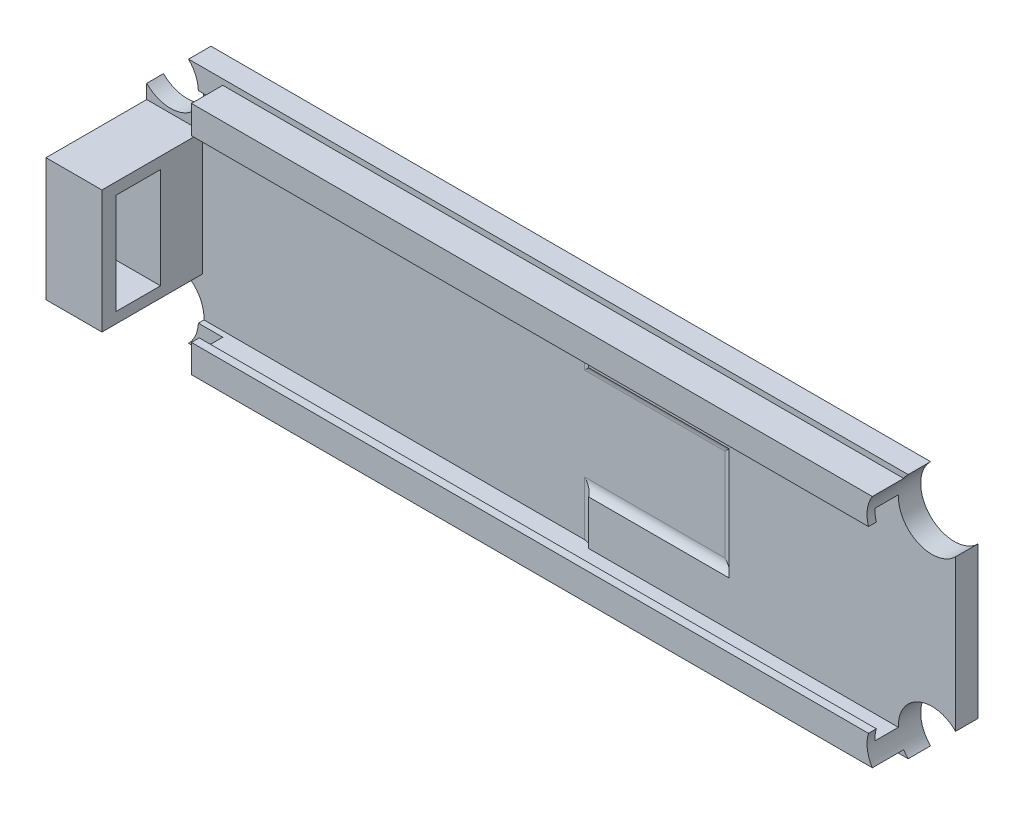
from build123d import *

# Parameters (mm, degrees)
SKIZZE1_W                       = 22
SKIZZE1_H                       = 72.8
AUFSATZ_LINEAR_AUSTRAGEN1_DEPTH = 2
SKIZZE2_R                       = 3
SCHNITT_LINEAR_AUSTRAGEN1_DEPTH = 2
SKIZZE3_W                       = 65.5
SKIZZE3_H                       = 21
AUFSATZ_LINEAR_AUSTRAGEN2_DEPTH = 2.8
SCHNITT_LINEAR_AUSTRAGEN2_DEPTH = 67.590464783
SKIZZE5_R                       = 3
SCHNITT_LINEAR_AUSTRAGEN4_DEPTH = 39.128729326
SKIZZE6_W                       = 18
SKIZZE6_H                       = 1
SCHNITT_LINEAR_AUSTRAGEN5_DEPTH = 40
SKIZZE8_W                       = 15
SKIZZE8_H                       = 10
SCHNITT_LINEAR_AUSTRAGEN6_DEPTH = 0.5
VERRUNDUNG3_R                   = 1
SKIZZE9_W                       = 5
SKIZZE9_H                       = 11
AUFSATZ_LINEAR_AUSTRAGEN3_DEPTH = 9
SKIZZE10_W                      = 9
SKIZZE10_H                      = 4
SCHNITT_LINEAR_AUSTRAGEN7_DEPTH = 75.371298227


with BuildPart() as part:
    # Skizze1 → Aufsatz-Linear austragen1 (new body)
    with BuildSketch(Plane(origin=(0, 0, 0), x_dir=(0, 1, 0), z_dir=(0, 0, 1))):
        Rectangle(SKIZZE1_W, SKIZZE1_H)
    extrude(amount=AUFSATZ_LINEAR_AUSTRAGEN1_DEPTH)

    # Skizze2 → Schnitt-Linear austragen1 (cut)
    with BuildSketch(Plane.XY.offset(2)):
        with Locations((-34.28, 8.88)):
            Circle(SKIZZE2_R)
        with Locations((-34.28, -8.88)):
            Circle(SKIZZE2_R)
        with Locations((34.28, -8.88)):
            Circle(SKIZZE2_R)
        with Locations((34.28, 8.88)):
            Circle(SKIZZE2_R)
    extrude(amount=-SCHNITT_LINEAR_AUSTRAGEN1_DEPTH, mode=Mode.SUBTRACT)

    # Skizze3 → Aufsatz-Linear austragen2 (add)
    with BuildSketch(Plane.XY.offset(2)):
        with Locations((3.65, 0)):
            Rectangle(SKIZZE3_W, SKIZZE3_H)
    extrude(amount=AUFSATZ_LINEAR_AUSTRAGEN2_DEPTH)

    # Skizze4 → Schnitt-Linear austragen2 (cut, through all)
    with BuildSketch(Plane(origin=(-29.1, 0, 0), x_dir=(0, -1, 0), z_dir=(-1, 0, 0))):
        Polygon((-8, 4.8), (8, 4.8), (8, 4.1), (9, 4.1), (9, 2), (-9, 2), (-9, 4.1), (-8, 4.1), align=None)
    extrude(amount=-SCHNITT_LINEAR_AUSTRAGEN2_DEPTH, mode=Mode.SUBTRACT)

    # Skizze5 → Schnitt-Linear austragen4 (cut, through all)
    with BuildSketch(Plane(origin=(0, 0, 2), x_dir=(1, 0, 0), z_dir=(0, 0, -1))):
        with Locations((34.28, -8.88)):
            Circle(SKIZZE5_R)
        with Locations((34.28, 8.88)):
            Circle(SKIZZE5_R)
    extrude(amount=-SCHNITT_LINEAR_AUSTRAGEN4_DEPTH, mode=Mode.SUBTRACT)

    # Skizze6 → Schnitt-Linear austragen5 (cut)
    with BuildSketch(Plane(origin=(-36.4, 0, 0), x_dir=(0, -1, 0), z_dir=(-1, 0, 0))):
        with Locations((0, 2)):
            Rectangle(SKIZZE6_W, SKIZZE6_H)
    extrude(amount=-SCHNITT_LINEAR_AUSTRAGEN5_DEPTH, mode=Mode.SUBTRACT)

    # Skizze8 → Schnitt-Linear austragen6 (cut)
    with BuildSketch(Plane.XY.offset(2)):
        with Locations((8.655984658, -0.007335612)):
            Rectangle(SKIZZE8_W, SKIZZE8_H)
    extrude(amount=-SCHNITT_LINEAR_AUSTRAGEN6_DEPTH, mode=Mode.SUBTRACT)

    # Verrundung3
    # the kernel refuses this fillet: 1 mm, written as the material it adds along each edge
    with BuildSketch(Plane(origin=(3.6, -9, 1.5), x_dir=(0, 0, 1), z_dir=(0, 1, 0))) as verrundung3_piece_1:
        with BuildLine():
            CenterArc((1, -0.866025404), VERRUNDUNG3_R, 120, 60)
            Line((0, -0.866025404), (-0.02, -0.866025404))
            Line((-0.02, -0.866025404), (-0.02, 0))
            Line((-0.02, 0), (0, 0.02))
            ThreePointArc((0, 0.02), (0.25, 0.02), (0.49, 0.017320508))
            Line((0.49, 0.017320508), (0.5, 0))
        make_face()
    extrude(amount=3.992664388)
    with BuildSketch(Plane(origin=(3.6, -5.007335612, 1.5), x_dir=(0, 0, 1), z_dir=(1, 0, 0)), Plane(origin=(16.155984658, 4.992664388, 1.5), x_dir=(0, 0, 1), z_dir=(-1, 0, 0))) as verrundung3_piece_2:
        with BuildLine():
            CenterArc((1, -0.866025404), VERRUNDUNG3_R, 120, 60)
            Line((0, -0.866025404), (-0.02, -0.866025404))
            Line((-0.02, -0.866025404), (-0.02, 0))
            Line((-0.02, 0), (0, 0.02))
            ThreePointArc((0, 0.02), (0.25, 0.02), (0.49, 0.017320508))
            Line((0.49, 0.017320508), (0.5, 0))
        make_face()
    extrude(amount=12.555984658)
    with BuildSketch(Plane(origin=(3.6, 4.992664388, 1.5), x_dir=(0, 0, 1), z_dir=(0, 1, 0))) as verrundung3_piece_3:
        with BuildLine():
            CenterArc((1, -0.866025404), VERRUNDUNG3_R, 120, 60)
            Line((0, -0.866025404), (-0.02, -0.866025404))
            Line((-0.02, -0.866025404), (-0.02, 0))
            Line((-0.02, 0), (0, 0.02))
            ThreePointArc((0, 0.02), (0.25, 0.02), (0.49, 0.017320508))
            Line((0.49, 0.017320508), (0.5, 0))
        make_face()
    extrude(amount=4.007335612)
    with BuildSketch(Plane(origin=(16.155984658, -5.007335612, 1.5), x_dir=(0, 0, 1), z_dir=(0, 1, 0))) as verrundung3_piece_4:
        with BuildLine():
            CenterArc((1, -0.866025404), VERRUNDUNG3_R, 120, 60)
            Line((0, -0.866025404), (-0.02, -0.866025404))
            Line((-0.02, -0.866025404), (-0.02, 0))
            Line((-0.02, 0), (0, 0.02))
            ThreePointArc((0, 0.02), (0.25, 0.02), (0.49, 0.017320508))
            Line((0.49, 0.017320508), (0.5, 0))
        make_face()
    extrude(amount=10)
    with BuildSketch(Plane(origin=(3.6, -9, 1.5), x_dir=(0, 0, 1), z_dir=(0, 1, 0))) as verrundung3_piece_5a_section:
        with BuildLine():
            CenterArc((1, -0.866025404), VERRUNDUNG3_R, 120, 60)
            Line((0, -0.866025404), (-0.02, -0.866025404))
            Line((-0.02, -0.866025404), (-0.02, 0))
            Line((-0.02, 0), (0, 0.02))
            ThreePointArc((0, 0.02), (0.25, 0.02), (0.49, 0.017320508))
            Line((0.49, 0.017320508), (0.5, 0))
        make_face()
    verrundung3_piece_5a = extrude(amount=6.157727897, mode=Mode.PRIVATE)
    verrundung3_piece_5a = split(verrundung3_piece_5a, bisect_by=Plane(origin=(3.383689554, -5.007335612, 1.629516711), z_dir=(0, 1, 0)), keep=Keep.TOP, mode=Mode.PRIVATE)
    with BuildSketch(Plane(origin=(1.434936491, -5.007335612, 1.5), x_dir=(0, 0, 1), z_dir=(1, 0, 0))) as verrundung3_piece_5b_section:
        with BuildLine():
            CenterArc((1, -0.866025404), VERRUNDUNG3_R, 120, 60)
            Line((0, -0.866025404), (-0.02, -0.866025404))
            Line((-0.02, -0.866025404), (-0.02, 0))
            Line((-0.02, 0), (0, 0.02))
            ThreePointArc((0, 0.02), (0.25, 0.02), (0.49, 0.017320508))
            Line((0.49, 0.017320508), (0.5, 0))
        make_face()
    verrundung3_piece_5b = extrude(amount=14.721048168, mode=Mode.PRIVATE)
    verrundung3_piece_5b = split(verrundung3_piece_5b, bisect_by=Plane(origin=(3.6, -4.791025166, 1.629516711), z_dir=(-1, 0, 0)), keep=Keep.TOP, mode=Mode.PRIVATE)
    verrundung3_piece_5 = verrundung3_piece_5a & verrundung3_piece_5b
    add(verrundung3_piece_5)
    with BuildSketch(Plane(origin=(3.6, -5.007335612, 1.5), x_dir=(0, 0, 1), z_dir=(1, 0, 0))) as verrundung3_piece_6a_section:
        with BuildLine():
            CenterArc((1, -0.866025404), VERRUNDUNG3_R, 120, 60)
            Line((0, -0.866025404), (-0.02, -0.866025404))
            Line((-0.02, -0.866025404), (-0.02, 0))
            Line((-0.02, 0), (0, 0.02))
            ThreePointArc((0, 0.02), (0.25, 0.02), (0.49, 0.017320508))
            Line((0.49, 0.017320508), (0.5, 0))
        make_face()
    verrundung3_piece_6a = extrude(amount=14.721048168, mode=Mode.PRIVATE)
    verrundung3_piece_6a = split(verrundung3_piece_6a, bisect_by=Plane(origin=(16.155984658, -4.791025166, 1.629516711), z_dir=(1, 0, 0)), keep=Keep.TOP, mode=Mode.PRIVATE)
    with BuildSketch(Plane(origin=(16.155984658, -7.172399122, 1.5), x_dir=(0, 0, 1), z_dir=(0, 1, 0))) as verrundung3_piece_6b_section:
        with BuildLine():
            CenterArc((1, -0.866025404), VERRUNDUNG3_R, 120, 60)
            Line((0, -0.866025404), (-0.02, -0.866025404))
            Line((-0.02, -0.866025404), (-0.02, 0))
            Line((-0.02, 0), (0, 0.02))
            ThreePointArc((0, 0.02), (0.25, 0.02), (0.49, 0.017320508))
            Line((0.49, 0.017320508), (0.5, 0))
        make_face()
    verrundung3_piece_6b = extrude(amount=12.165063509, mode=Mode.PRIVATE)
    verrundung3_piece_6b = split(verrundung3_piece_6b, bisect_by=Plane(origin=(15.939674213, -5.007335612, 1.629516711), z_dir=(0, -1, 0)), keep=Keep.TOP, mode=Mode.PRIVATE)
    verrundung3_piece_6 = verrundung3_piece_6a & verrundung3_piece_6b
    add(verrundung3_piece_6)
    with BuildSketch(Plane(origin=(16.155984658, 4.992664388, 1.5), x_dir=(0, 0, 1), z_dir=(-1, 0, 0))) as verrundung3_piece_7a_section:
        with BuildLine():
            CenterArc((1, -0.866025404), VERRUNDUNG3_R, 120, 60)
            Line((0, -0.866025404), (-0.02, -0.866025404))
            Line((-0.02, -0.866025404), (-0.02, 0))
            Line((-0.02, 0), (0, 0.02))
            ThreePointArc((0, 0.02), (0.25, 0.02), (0.49, 0.017320508))
            Line((0.49, 0.017320508), (0.5, 0))
        make_face()
    verrundung3_piece_7a = extrude(amount=14.721048168, mode=Mode.PRIVATE)
    verrundung3_piece_7a = split(verrundung3_piece_7a, bisect_by=Plane(origin=(3.6, 4.776353942, 1.629516711), z_dir=(-1, 0, 0)), keep=Keep.TOP, mode=Mode.PRIVATE)
    with BuildSketch(Plane(origin=(3.6, 2.827600878, 1.5), x_dir=(0, 0, 1), z_dir=(0, 1, 0))) as verrundung3_piece_7b_section:
        with BuildLine():
            CenterArc((1, -0.866025404), VERRUNDUNG3_R, 120, 60)
            Line((0, -0.866025404), (-0.02, -0.866025404))
            Line((-0.02, -0.866025404), (-0.02, 0))
            Line((-0.02, 0), (0, 0.02))
            ThreePointArc((0, 0.02), (0.25, 0.02), (0.49, 0.017320508))
            Line((0.49, 0.017320508), (0.5, 0))
        make_face()
    verrundung3_piece_7b = extrude(amount=6.172399122, mode=Mode.PRIVATE)
    verrundung3_piece_7b = split(verrundung3_piece_7b, bisect_by=Plane(origin=(3.383689554, 4.992664388, 1.629516711), z_dir=(0, -1, 0)), keep=Keep.TOP, mode=Mode.PRIVATE)
    verrundung3_piece_7 = verrundung3_piece_7a & verrundung3_piece_7b
    add(verrundung3_piece_7)
    with BuildSketch(Plane(origin=(16.155984658, -5.007335612, 1.5), x_dir=(0, 0, 1), z_dir=(0, 1, 0))) as verrundung3_piece_8a_section:
        with BuildLine():
            CenterArc((1, -0.866025404), VERRUNDUNG3_R, 120, 60)
            Line((0, -0.866025404), (-0.02, -0.866025404))
            Line((-0.02, -0.866025404), (-0.02, 0))
            Line((-0.02, 0), (0, 0.02))
            ThreePointArc((0, 0.02), (0.25, 0.02), (0.49, 0.017320508))
            Line((0.49, 0.017320508), (0.5, 0))
        make_face()
    verrundung3_piece_8a = extrude(amount=12.165063509, mode=Mode.PRIVATE)
    verrundung3_piece_8a = split(verrundung3_piece_8a, bisect_by=Plane(origin=(15.939674213, 4.992664388, 1.629516711), z_dir=(0, 1, 0)), keep=Keep.TOP, mode=Mode.PRIVATE)
    with BuildSketch(Plane(origin=(18.321048168, 4.992664388, 1.5), x_dir=(0, 0, 1), z_dir=(-1, 0, 0))) as verrundung3_piece_8b_section:
        with BuildLine():
            CenterArc((1, -0.866025404), VERRUNDUNG3_R, 120, 60)
            Line((0, -0.866025404), (-0.02, -0.866025404))
            Line((-0.02, -0.866025404), (-0.02, 0))
            Line((-0.02, 0), (0, 0.02))
            ThreePointArc((0, 0.02), (0.25, 0.02), (0.49, 0.017320508))
            Line((0.49, 0.017320508), (0.5, 0))
        make_face()
    verrundung3_piece_8b = extrude(amount=14.721048168, mode=Mode.PRIVATE)
    verrundung3_piece_8b = split(verrundung3_piece_8b, bisect_by=Plane(origin=(16.155984658, 4.776353942, 1.629516711), z_dir=(1, 0, 0)), keep=Keep.TOP, mode=Mode.PRIVATE)
    verrundung3_piece_8 = verrundung3_piece_8a & verrundung3_piece_8b
    add(verrundung3_piece_8)

    # Skizze9 → Aufsatz-Linear austragen3 (add)
    with BuildSketch(Plane.XY.offset(1.5)):
        with Locations((-33.9, 0)):
            Rectangle(SKIZZE9_W, SKIZZE9_H)
    extrude(amount=AUFSATZ_LINEAR_AUSTRAGEN3_DEPTH)

    # Skizze10 → Schnitt-Linear austragen7 (cut, through all)
    with BuildSketch(Plane(origin=(-36.4, 0, 0), x_dir=(0, -1, 0), z_dir=(-1, 0, 0))):
        with Locations((0.038201858, 7.263431172)):
            Rectangle(SKIZZE10_W, SKIZZE10_H)
    extrude(amount=-SCHNITT_LINEAR_AUSTRAGEN7_DEPTH, mode=Mode.SUBTRACT)


solid = part.part
